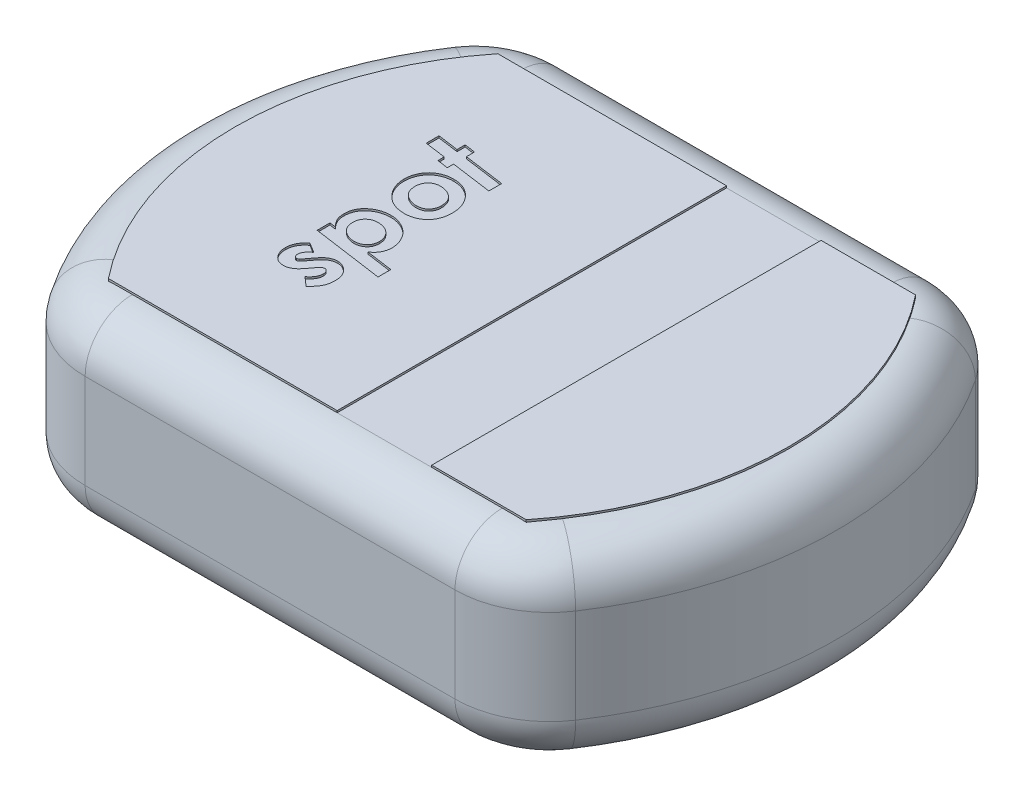
from build123d import *

# Parameters (mm, degrees)
BOSS_EXTRUDE1_DEPTH = 25.4
BOSS_EXTRUDE2_DEPTH = 0.254
FILLET1_R           = 12.7
FILLET2_R           = 6.35
SKETCH3_W           = 12.7
SKETCH3_H           = 52.324
CUT_EXTRUDE3_DEPTH  = 0.254
CUT_EXTRUDE4_DEPTH  = 0.254


with BuildPart() as part:
    # Sketch1 → Boss-Extrude1 (new body)
    with BuildSketch(Plane(origin=(0, 0, 0), x_dir=(1, 0, 0), z_dir=(0, 1, 0))):
        with BuildLine():
            Line((-31, 32.512), (31, 32.512))
            ThreePointArc((31, 32.512), (43.561, 0), (31, -32.512))
            Line((31, -32.512), (-31, -32.512))
            ThreePointArc((-31, -32.512), (-43.561, 0), (-31, 32.512))
        make_face()
    extrude(amount=BOSS_EXTRUDE1_DEPTH)

    # Sketch2 → Boss-Extrude2 (add)
    with BuildSketch(Plane(origin=(0, 25.4, 0), x_dir=(1, 0, 0), z_dir=(0, 1, 0))):
        with BuildLine():
            Line((-28.069276307, -26.162), (28.069276307, -26.162))
            ThreePointArc((28.069276307, -26.162), (37.211, 0), (28.069276307, 26.162))
            Line((28.069276307, 26.162), (-28.069276307, 26.162))
            ThreePointArc((-28.069276307, 26.162), (-37.211, 0), (-28.069276307, -26.162))
        make_face()
    extrude(amount=BOSS_EXTRUDE2_DEPTH)

    # Fillet1
    fillet1_edges = [part.edges().sort_by_distance(p)[0] for p in [
        (-31, 12.7, -32.512),
        (31, 12.7, -32.512),
        (31, 12.7, 32.512),
        (-31, 12.7, 32.512),
    ]]
    fillet(fillet1_edges, radius=FILLET1_R)

    # Fillet2
    # the kernel refuses this fillet: 6.35 mm, written as the material it takes off along each edge
    with BuildSketch(Plane(origin=(4.795375488, 0, 0), x_dir=(-0.8314250243964912, 0, 0.5556369577406582), z_dir=(0.5556369577406582, 0, 0.8314250243964912))) as fillet2_piece_1:
        with BuildLine():
            CenterArc((48.356375488 - FILLET2_R, -FILLET2_R), FILLET2_R, 0, 90)
            Line((48.356375488, -FILLET2_R), (48.356375488 + FILLET2_R * 0.02, -FILLET2_R))
            Line((48.356375488 + FILLET2_R * 0.02, -FILLET2_R), (48.356375488 + FILLET2_R * 0.02, FILLET2_R * 0.02))
            Line((48.356375488 + FILLET2_R * 0.02, FILLET2_R * 0.02), (48.356375488 - FILLET2_R, FILLET2_R * 0.02))
            Line((48.356375488 - FILLET2_R, FILLET2_R * 0.02), (48.356375488 - FILLET2_R, 0))
        make_face()
    revolve(axis=Axis((4.795375488, 0, 0), (0, -1, 0)), revolution_arc=67.509196121, mode=Mode.SUBTRACT)
    with BuildSketch(Plane(origin=(4.795375488, 25.4, 0), x_dir=(-0.8314250243964912, 0, 0.5556369577406582), z_dir=(0.5556369577406582, 0, 0.8314250243964912))) as fillet2_piece_2:
        with BuildLine():
            CenterArc((48.356375488 - FILLET2_R, FILLET2_R), FILLET2_R, 270, 90)
            Line((48.356375488, FILLET2_R), (48.356375488 + FILLET2_R * 0.02, FILLET2_R))
            Line((48.356375488 + FILLET2_R * 0.02, FILLET2_R), (48.356375488 + FILLET2_R * 0.02, -FILLET2_R * 0.02))
            Line((48.356375488 + FILLET2_R * 0.02, -FILLET2_R * 0.02), (48.356375488 - FILLET2_R, -FILLET2_R * 0.02))
            Line((48.356375488 - FILLET2_R, -FILLET2_R * 0.02), (48.356375488 - FILLET2_R, 0))
        make_face()
    revolve(axis=Axis((4.795375488, 25.4, 0), (0, -1, 0)), revolution_arc=67.509196121, mode=Mode.SUBTRACT)
    with BuildSketch(Plane(origin=(-24.850227372, 0, -32.512), x_dir=(0, 1, 0), z_dir=(1, 0, 0)), Plane(origin=(24.850227372, 25.4, 32.512), x_dir=(0, 0, -1), z_dir=(-1, 0, 0))) as fillet2_piece_3:
        with BuildLine():
            CenterArc((FILLET2_R, FILLET2_R), FILLET2_R, 180, 90)
            Line((0, FILLET2_R), (-FILLET2_R * 0.02, FILLET2_R))
            Line((-FILLET2_R * 0.02, FILLET2_R), (-FILLET2_R * 0.02, -FILLET2_R * 0.02))
            Line((-FILLET2_R * 0.02, -FILLET2_R * 0.02), (FILLET2_R, -FILLET2_R * 0.02))
            Line((FILLET2_R, -FILLET2_R * 0.02), (FILLET2_R, 0))
        make_face()
    extrude(amount=49.700454744, mode=Mode.SUBTRACT)
    with BuildSketch(Plane(origin=(-4.795375488, 0, 0), x_dir=(0.8314250243964905, 0, -0.5556369577406595), z_dir=(-0.5556369577406595, 0, -0.8314250243964905))) as fillet2_piece_4:
        with BuildLine():
            CenterArc((48.356375488 - FILLET2_R, -FILLET2_R), FILLET2_R, 0, 90)
            Line((48.356375488, -FILLET2_R), (48.356375488 + FILLET2_R * 0.02, -FILLET2_R))
            Line((48.356375488 + FILLET2_R * 0.02, -FILLET2_R), (48.356375488 + FILLET2_R * 0.02, FILLET2_R * 0.02))
            Line((48.356375488 + FILLET2_R * 0.02, FILLET2_R * 0.02), (48.356375488 - FILLET2_R, FILLET2_R * 0.02))
            Line((48.356375488 - FILLET2_R, FILLET2_R * 0.02), (48.356375488 - FILLET2_R, 0))
        make_face()
    revolve(axis=Axis((-4.795375488, 0, 0), (0, -1, 0)), revolution_arc=67.509196121, mode=Mode.SUBTRACT)
    with BuildSketch(Plane(origin=(24.850227372, 0, 32.512), x_dir=(0, 0, -1), z_dir=(-1, 0, 0)), Plane(origin=(-24.850227372, 25.4, -32.512), x_dir=(0, -1, 0), z_dir=(1, 0, 0))) as fillet2_piece_5:
        with BuildLine():
            CenterArc((FILLET2_R, -FILLET2_R), FILLET2_R, 90, 90)
            Line((0, -FILLET2_R), (-FILLET2_R * 0.02, -FILLET2_R))
            Line((-FILLET2_R * 0.02, -FILLET2_R), (-FILLET2_R * 0.02, FILLET2_R * 0.02))
            Line((-FILLET2_R * 0.02, FILLET2_R * 0.02), (FILLET2_R, FILLET2_R * 0.02))
            Line((FILLET2_R, FILLET2_R * 0.02), (FILLET2_R, 0))
        make_face()
    extrude(amount=49.700454744, mode=Mode.SUBTRACT)
    with BuildSketch(Plane(origin=(-24.850227372, 0, 19.812), x_dir=(-0.8314250243964914, 0, 0.5556369577406579), z_dir=(-0.5556369577406579, 0, -0.8314250243964914))) as fillet2_piece_6:
        with BuildLine():
            CenterArc((12.7 - FILLET2_R, FILLET2_R), FILLET2_R, 270, 90)
            Line((12.7, FILLET2_R), (12.7 + FILLET2_R * 0.02, FILLET2_R))
            Line((12.7 + FILLET2_R * 0.02, FILLET2_R), (12.7 + FILLET2_R * 0.02, -FILLET2_R * 0.02))
            Line((12.7 + FILLET2_R * 0.02, -FILLET2_R * 0.02), (12.7 - FILLET2_R, -FILLET2_R * 0.02))
            Line((12.7 - FILLET2_R, -FILLET2_R * 0.02), (12.7 - FILLET2_R, 0))
        make_face()
    revolve(axis=Axis((-24.850227372, 0, 19.812), (0, 1, 0)), revolution_arc=56.24540194, mode=Mode.SUBTRACT)
    with BuildSketch(Plane(origin=(24.850227372, 0, 19.812), x_dir=(0.8314250243964914, 0, 0.5556369577406579), z_dir=(0.5556369577406579, 0, -0.8314250243964914))) as fillet2_piece_7:
        with BuildLine():
            CenterArc((12.7 - FILLET2_R, -FILLET2_R), FILLET2_R, 0, 90)
            Line((12.7, -FILLET2_R), (12.7 + FILLET2_R * 0.02, -FILLET2_R))
            Line((12.7 + FILLET2_R * 0.02, -FILLET2_R), (12.7 + FILLET2_R * 0.02, FILLET2_R * 0.02))
            Line((12.7 + FILLET2_R * 0.02, FILLET2_R * 0.02), (12.7 - FILLET2_R, FILLET2_R * 0.02))
            Line((12.7 - FILLET2_R, FILLET2_R * 0.02), (12.7 - FILLET2_R, 0))
        make_face()
    revolve(axis=Axis((24.850227372, 0, 19.812), (0, -1, 0)), revolution_arc=56.24540194, mode=Mode.SUBTRACT)
    with BuildSketch(Plane(origin=(24.850227372, 0, -19.812), x_dir=(0, 0, -1), z_dir=(-1, 0, 0))) as fillet2_piece_8:
        with BuildLine():
            CenterArc((12.7 - FILLET2_R, -FILLET2_R), FILLET2_R, 0, 90)
            Line((12.7, -FILLET2_R), (12.7 + FILLET2_R * 0.02, -FILLET2_R))
            Line((12.7 + FILLET2_R * 0.02, -FILLET2_R), (12.7 + FILLET2_R * 0.02, FILLET2_R * 0.02))
            Line((12.7 + FILLET2_R * 0.02, FILLET2_R * 0.02), (12.7 - FILLET2_R, FILLET2_R * 0.02))
            Line((12.7 - FILLET2_R, FILLET2_R * 0.02), (12.7 - FILLET2_R, 0))
        make_face()
    revolve(axis=Axis((24.850227372, 0, -19.812), (0, -1, 0)), revolution_arc=56.24540194, mode=Mode.SUBTRACT)
    with BuildSketch(Plane(origin=(-24.850227372, 0, -19.812), x_dir=(0, 0, -1), z_dir=(1, 0, 0))) as fillet2_piece_9:
        with BuildLine():
            CenterArc((12.7 - FILLET2_R, FILLET2_R), FILLET2_R, 270, 90)
            Line((12.7, FILLET2_R), (12.7 + FILLET2_R * 0.02, FILLET2_R))
            Line((12.7 + FILLET2_R * 0.02, FILLET2_R), (12.7 + FILLET2_R * 0.02, -FILLET2_R * 0.02))
            Line((12.7 + FILLET2_R * 0.02, -FILLET2_R * 0.02), (12.7 - FILLET2_R, -FILLET2_R * 0.02))
            Line((12.7 - FILLET2_R, -FILLET2_R * 0.02), (12.7 - FILLET2_R, 0))
        make_face()
    revolve(axis=Axis((-24.850227372, 0, -19.812), (0, 1, 0)), revolution_arc=56.24540194, mode=Mode.SUBTRACT)
    with BuildSketch(Plane(origin=(-4.795375488, 25.4, 0), x_dir=(0.8314250243964905, 0, -0.5556369577406595), z_dir=(-0.5556369577406595, 0, -0.8314250243964905))) as fillet2_piece_10:
        with BuildLine():
            CenterArc((48.356375488 - FILLET2_R, FILLET2_R), FILLET2_R, 270, 90)
            Line((48.356375488, FILLET2_R), (48.356375488 + FILLET2_R * 0.02, FILLET2_R))
            Line((48.356375488 + FILLET2_R * 0.02, FILLET2_R), (48.356375488 + FILLET2_R * 0.02, -FILLET2_R * 0.02))
            Line((48.356375488 + FILLET2_R * 0.02, -FILLET2_R * 0.02), (48.356375488 - FILLET2_R, -FILLET2_R * 0.02))
            Line((48.356375488 - FILLET2_R, -FILLET2_R * 0.02), (48.356375488 - FILLET2_R, 0))
        make_face()
    revolve(axis=Axis((-4.795375488, 25.4, 0), (0, -1, 0)), revolution_arc=67.509196121, mode=Mode.SUBTRACT)
    with BuildSketch(Plane(origin=(-24.850227372, 25.4, 19.812), x_dir=(-0.8314250243964914, 0, 0.5556369577406579), z_dir=(-0.5556369577406579, 0, -0.8314250243964914))) as fillet2_piece_11_section:
        with BuildLine():
            CenterArc((12.7 - FILLET2_R, -FILLET2_R), FILLET2_R, 0, 90)
            Line((12.7, -FILLET2_R), (12.7 + FILLET2_R * 0.02, -FILLET2_R))
            Line((12.7 + FILLET2_R * 0.02, -FILLET2_R), (12.7 + FILLET2_R * 0.02, FILLET2_R * 0.02))
            Line((12.7 + FILLET2_R * 0.02, FILLET2_R * 0.02), (12.7 - FILLET2_R, FILLET2_R * 0.02))
            Line((12.7 - FILLET2_R, FILLET2_R * 0.02), (12.7 - FILLET2_R, 0))
        make_face()
    fillet2_piece_11 = revolve(axis=Axis((-24.850227372, 25.4, 19.812), (0, 1, 0)), revolution_arc=56.24540194, mode=Mode.PRIVATE)
    fillet2_piece_11 = fillet2_piece_11 - Plane(origin=(4.795375488, 25.075741266, 0), x_dir=(-0.7823729472848935, 0, -0.6228102209796731), z_dir=(0, -1, 0)) * Cylinder(42.006375488, 52, mode=Mode.PRIVATE)
    fillet2_piece_11 = split(fillet2_piece_11, bisect_by=Plane(origin=(-31.876224532, 25.075741266, 26.162), z_dir=(0, 0, -1)), keep=Keep.TOP, mode=Mode.PRIVATE)
    add(fillet2_piece_11, mode=Mode.SUBTRACT)
    with BuildSketch(Plane(origin=(-24.850227372, 25.4, 19.812), x_dir=(-0.8314250243964914, 0, 0.5556369577406579), z_dir=(-0.5556369577406579, 0, -0.8314250243964914))) as fillet2_piece_12_section:
        with BuildLine():
            CenterArc((12.7 - FILLET2_R, -FILLET2_R), FILLET2_R, 0, 90)
            Line((12.7, -FILLET2_R), (12.7 + FILLET2_R * 0.02, -FILLET2_R))
            Line((12.7 + FILLET2_R * 0.02, -FILLET2_R), (12.7 + FILLET2_R * 0.02, FILLET2_R * 0.02))
            Line((12.7 + FILLET2_R * 0.02, FILLET2_R * 0.02), (12.7 - FILLET2_R, FILLET2_R * 0.02))
            Line((12.7 - FILLET2_R, FILLET2_R * 0.02), (12.7 - FILLET2_R, 0))
        make_face()
    fillet2_piece_12 = revolve(axis=Axis((-24.850227372, 25.4, 19.812), (0, 1, 0)), revolution_arc=56.24540194, mode=Mode.PRIVATE)
    fillet2_piece_12 = fillet2_piece_12 & Plane(origin=(4.795375488, 25.294711271, 0), x_dir=(-0.7823729472848935, 0, -0.6228102209796731), z_dir=(0, -1, 0)) * Cylinder(42.006375488, 52, mode=Mode.PRIVATE)
    fillet2_piece_12 = split(fillet2_piece_12, bisect_by=Plane(origin=(-25.742042557, 25.294711271, 26.162), z_dir=(0, 0, 1)), keep=Keep.TOP, mode=Mode.PRIVATE)
    add(fillet2_piece_12, mode=Mode.SUBTRACT)
    with BuildSketch(Plane(origin=(-24.850227372, 25.4, 19.812), x_dir=(-0.8314250243964914, 0, 0.5556369577406579), z_dir=(-0.5556369577406579, 0, -0.8314250243964914))) as fillet2_piece_13_section:
        with BuildLine():
            CenterArc((12.7 - FILLET2_R, -FILLET2_R), FILLET2_R, 0, 90)
            Line((12.7, -FILLET2_R), (12.7 + FILLET2_R * 0.02, -FILLET2_R))
            Line((12.7 + FILLET2_R * 0.02, -FILLET2_R), (12.7 + FILLET2_R * 0.02, FILLET2_R * 0.02))
            Line((12.7 + FILLET2_R * 0.02, FILLET2_R * 0.02), (12.7 - FILLET2_R, FILLET2_R * 0.02))
            Line((12.7 - FILLET2_R, FILLET2_R * 0.02), (12.7 - FILLET2_R, 0))
        make_face()
    fillet2_piece_13 = revolve(axis=Axis((-24.850227372, 25.4, 19.812), (0, 1, 0)), revolution_arc=56.24540194, mode=Mode.PRIVATE)
    fillet2_piece_13 = fillet2_piece_13 - Plane(origin=(4.795375488, 23.784162889, 0), x_dir=(-0.7823729472848935, 0, -0.6228102209796731), z_dir=(0, -1, 0)) * Cylinder(42.006375488, 52, mode=Mode.PRIVATE)
    fillet2_piece_13 = split(fillet2_piece_13, bisect_by=Plane(origin=(-30.028937525, 23.784162889, 26.162), z_dir=(0, 0, 1)), keep=Keep.TOP, mode=Mode.PRIVATE)
    add(fillet2_piece_13, mode=Mode.SUBTRACT)
    with BuildSketch(Plane(origin=(24.850227372, 25.4, 19.812), x_dir=(0.8314250243964914, 0, 0.5556369577406579), z_dir=(0.5556369577406579, 0, -0.8314250243964914))) as fillet2_piece_14_section:
        with BuildLine():
            CenterArc((12.7 - FILLET2_R, FILLET2_R), FILLET2_R, 270, 90)
            Line((12.7, FILLET2_R), (12.7 + FILLET2_R * 0.02, FILLET2_R))
            Line((12.7 + FILLET2_R * 0.02, FILLET2_R), (12.7 + FILLET2_R * 0.02, -FILLET2_R * 0.02))
            Line((12.7 + FILLET2_R * 0.02, -FILLET2_R * 0.02), (12.7 - FILLET2_R, -FILLET2_R * 0.02))
            Line((12.7 - FILLET2_R, -FILLET2_R * 0.02), (12.7 - FILLET2_R, 0))
        make_face()
    fillet2_piece_14 = revolve(axis=Axis((24.850227372, 25.4, 19.812), (0, -1, 0)), revolution_arc=56.24540194, mode=Mode.PRIVATE)
    fillet2_piece_14 = fillet2_piece_14 - Plane(origin=(-4.795375488, 25.075741312, 0), x_dir=(0.7823729472848935, 0, 0.6228102209796733), z_dir=(0, -1, 0)) * Cylinder(42.006375488, 52, mode=Mode.PRIVATE)
    fillet2_piece_14 = split(fillet2_piece_14, bisect_by=Plane(origin=(31.876224679, 25.075741312, 26.162), z_dir=(0, 0, -1)), keep=Keep.TOP, mode=Mode.PRIVATE)
    add(fillet2_piece_14, mode=Mode.SUBTRACT)
    with BuildSketch(Plane(origin=(24.850227372, 25.4, 19.812), x_dir=(0.8314250243964914, 0, 0.5556369577406579), z_dir=(0.5556369577406579, 0, -0.8314250243964914))) as fillet2_piece_15_section:
        with BuildLine():
            CenterArc((12.7 - FILLET2_R, FILLET2_R), FILLET2_R, 270, 90)
            Line((12.7, FILLET2_R), (12.7 + FILLET2_R * 0.02, FILLET2_R))
            Line((12.7 + FILLET2_R * 0.02, FILLET2_R), (12.7 + FILLET2_R * 0.02, -FILLET2_R * 0.02))
            Line((12.7 + FILLET2_R * 0.02, -FILLET2_R * 0.02), (12.7 - FILLET2_R, -FILLET2_R * 0.02))
            Line((12.7 - FILLET2_R, -FILLET2_R * 0.02), (12.7 - FILLET2_R, 0))
        make_face()
    fillet2_piece_15 = revolve(axis=Axis((24.850227372, 25.4, 19.812), (0, -1, 0)), revolution_arc=56.24540194, mode=Mode.PRIVATE)
    fillet2_piece_15 = fillet2_piece_15 & Plane(origin=(-4.795375488, 25.294711254, 0), x_dir=(0.7823729472848935, 0, 0.6228102209796733), z_dir=(0, -1, 0)) * Cylinder(42.006375488, 52, mode=Mode.PRIVATE)
    fillet2_piece_15 = split(fillet2_piece_15, bisect_by=Plane(origin=(25.742042624, 25.294711254, 26.162), z_dir=(0, 0, 1)), keep=Keep.TOP, mode=Mode.PRIVATE)
    add(fillet2_piece_15, mode=Mode.SUBTRACT)
    with BuildSketch(Plane(origin=(24.850227372, 25.4, 19.812), x_dir=(0.8314250243964914, 0, 0.5556369577406579), z_dir=(0.5556369577406579, 0, -0.8314250243964914))) as fillet2_piece_16_section:
        with BuildLine():
            CenterArc((12.7 - FILLET2_R, FILLET2_R), FILLET2_R, 270, 90)
            Line((12.7, FILLET2_R), (12.7 + FILLET2_R * 0.02, FILLET2_R))
            Line((12.7 + FILLET2_R * 0.02, FILLET2_R), (12.7 + FILLET2_R * 0.02, -FILLET2_R * 0.02))
            Line((12.7 + FILLET2_R * 0.02, -FILLET2_R * 0.02), (12.7 - FILLET2_R, -FILLET2_R * 0.02))
            Line((12.7 - FILLET2_R, -FILLET2_R * 0.02), (12.7 - FILLET2_R, 0))
        make_face()
    fillet2_piece_16 = revolve(axis=Axis((24.850227372, 25.4, 19.812), (0, -1, 0)), revolution_arc=56.24540194, mode=Mode.PRIVATE)
    fillet2_piece_16 = fillet2_piece_16 - Plane(origin=(-4.795375488, 23.784162865, 0), x_dir=(0.7823729472848935, 0, 0.6228102209796733), z_dir=(0, -1, 0)) * Cylinder(42.006375488, 52, mode=Mode.PRIVATE)
    fillet2_piece_16 = split(fillet2_piece_16, bisect_by=Plane(origin=(30.028937498, 23.784162865, 26.162), z_dir=(0, 0, 1)), keep=Keep.TOP, mode=Mode.PRIVATE)
    add(fillet2_piece_16, mode=Mode.SUBTRACT)
    with BuildSketch(Plane(origin=(24.850227372, 25.4, -19.812), x_dir=(0, 0, -1), z_dir=(-1, 0, 0))) as fillet2_piece_17_section:
        with BuildLine():
            CenterArc((12.7 - FILLET2_R, FILLET2_R), FILLET2_R, 270, 90)
            Line((12.7 - FILLET2_R, 0), (12.7 - FILLET2_R, -FILLET2_R * 0.02))
            Line((12.7 - FILLET2_R, -FILLET2_R * 0.02), (12.7 + FILLET2_R * 0.02, -FILLET2_R * 0.02))
            Line((12.7 + FILLET2_R * 0.02, -FILLET2_R * 0.02), (12.7 + FILLET2_R * 0.02, FILLET2_R))
            Line((12.7 + FILLET2_R * 0.02, FILLET2_R), (12.7, FILLET2_R))
        make_face()
    fillet2_piece_17 = revolve(axis=Axis((24.850227372, 25.4, -19.812), (0, -1, 0)), revolution_arc=56.24540194, mode=Mode.PRIVATE)
    fillet2_piece_17 = split(fillet2_piece_17, bisect_by=Plane(origin=(30.028937546, 23.784162878, -26.162), z_dir=(0, 0, -1)), keep=Keep.TOP, mode=Mode.PRIVATE)
    fillet2_piece_17 = fillet2_piece_17 - Plane(origin=(-4.795375488, 23.784162878, 0), x_dir=(0.7823729472848935, 0, 0.6228102209796733), z_dir=(0, -1, 0)) * Cylinder(42.006375488, 52, mode=Mode.PRIVATE)
    add(fillet2_piece_17, mode=Mode.SUBTRACT)
    with BuildSketch(Plane(origin=(24.850227372, 25.4, -19.812), x_dir=(0, 0, -1), z_dir=(-1, 0, 0))) as fillet2_piece_18_section:
        with BuildLine():
            CenterArc((12.7 - FILLET2_R, FILLET2_R), FILLET2_R, 270, 90)
            Line((12.7 - FILLET2_R, 0), (12.7 - FILLET2_R, -FILLET2_R * 0.02))
            Line((12.7 - FILLET2_R, -FILLET2_R * 0.02), (12.7 + FILLET2_R * 0.02, -FILLET2_R * 0.02))
            Line((12.7 + FILLET2_R * 0.02, -FILLET2_R * 0.02), (12.7 + FILLET2_R * 0.02, FILLET2_R))
            Line((12.7 + FILLET2_R * 0.02, FILLET2_R), (12.7, FILLET2_R))
        make_face()
    fillet2_piece_18 = revolve(axis=Axis((24.850227372, 25.4, -19.812), (0, -1, 0)), revolution_arc=56.24540194, mode=Mode.PRIVATE)
    fillet2_piece_18 = split(fillet2_piece_18, bisect_by=Plane(origin=(25.742042551, 25.29471127, -26.162), z_dir=(0, 0, -1)), keep=Keep.TOP, mode=Mode.PRIVATE)
    fillet2_piece_18 = fillet2_piece_18 & Plane(origin=(-4.795375488, 25.29471127, 0), x_dir=(0.7823729472848935, 0, 0.6228102209796733), z_dir=(0, -1, 0)) * Cylinder(42.006375488, 52, mode=Mode.PRIVATE)
    add(fillet2_piece_18, mode=Mode.SUBTRACT)
    with BuildSketch(Plane(origin=(24.850227372, 25.4, -19.812), x_dir=(0, 0, -1), z_dir=(-1, 0, 0))) as fillet2_piece_19_section:
        with BuildLine():
            CenterArc((12.7 - FILLET2_R, FILLET2_R), FILLET2_R, 270, 90)
            Line((12.7 - FILLET2_R, 0), (12.7 - FILLET2_R, -FILLET2_R * 0.02))
            Line((12.7 - FILLET2_R, -FILLET2_R * 0.02), (12.7 + FILLET2_R * 0.02, -FILLET2_R * 0.02))
            Line((12.7 + FILLET2_R * 0.02, -FILLET2_R * 0.02), (12.7 + FILLET2_R * 0.02, FILLET2_R))
            Line((12.7 + FILLET2_R * 0.02, FILLET2_R), (12.7, FILLET2_R))
        make_face()
    fillet2_piece_19 = revolve(axis=Axis((24.850227372, 25.4, -19.812), (0, -1, 0)), revolution_arc=56.24540194, mode=Mode.PRIVATE)
    fillet2_piece_19 = split(fillet2_piece_19, bisect_by=Plane(origin=(31.876224423, 25.075741235, -26.162), z_dir=(0, 0, 1)), keep=Keep.TOP, mode=Mode.PRIVATE)
    fillet2_piece_19 = fillet2_piece_19 - Plane(origin=(-4.795375488, 25.075741235, 0), x_dir=(0.7823729472848935, 0, 0.6228102209796733), z_dir=(0, -1, 0)) * Cylinder(42.006375488, 52, mode=Mode.PRIVATE)
    add(fillet2_piece_19, mode=Mode.SUBTRACT)
    with BuildSketch(Plane(origin=(-24.850227372, 25.4, -19.812), x_dir=(0, 0, -1), z_dir=(1, 0, 0))) as fillet2_piece_20_section:
        with BuildLine():
            CenterArc((12.7 - FILLET2_R, -FILLET2_R), FILLET2_R, 0, 90)
            Line((12.7 - FILLET2_R, 0), (12.7 - FILLET2_R, FILLET2_R * 0.02))
            Line((12.7 - FILLET2_R, FILLET2_R * 0.02), (12.7 + FILLET2_R * 0.02, FILLET2_R * 0.02))
            Line((12.7 + FILLET2_R * 0.02, FILLET2_R * 0.02), (12.7 + FILLET2_R * 0.02, -FILLET2_R))
            Line((12.7 + FILLET2_R * 0.02, -FILLET2_R), (12.7, -FILLET2_R))
        make_face()
    fillet2_piece_20 = revolve(axis=Axis((-24.850227372, 25.4, -19.812), (0, 1, 0)), revolution_arc=56.24540194, mode=Mode.PRIVATE)
    fillet2_piece_20 = fillet2_piece_20 - Plane(origin=(4.795375488, 23.78416288, 0), x_dir=(-0.7823729472848935, 0, -0.6228102209796731), z_dir=(0, -1, 0)) * Cylinder(42.006375488, 52, mode=Mode.PRIVATE)
    fillet2_piece_20 = split(fillet2_piece_20, bisect_by=Plane(origin=(-30.028937479, 23.78416288, -26.162), z_dir=(0, 0, -1)), keep=Keep.TOP, mode=Mode.PRIVATE)
    add(fillet2_piece_20, mode=Mode.SUBTRACT)
    with BuildSketch(Plane(origin=(-24.850227372, 25.4, -19.812), x_dir=(0, 0, -1), z_dir=(1, 0, 0))) as fillet2_piece_21_section:
        with BuildLine():
            CenterArc((12.7 - FILLET2_R, -FILLET2_R), FILLET2_R, 0, 90)
            Line((12.7 - FILLET2_R, 0), (12.7 - FILLET2_R, FILLET2_R * 0.02))
            Line((12.7 - FILLET2_R, FILLET2_R * 0.02), (12.7 + FILLET2_R * 0.02, FILLET2_R * 0.02))
            Line((12.7 + FILLET2_R * 0.02, FILLET2_R * 0.02), (12.7 + FILLET2_R * 0.02, -FILLET2_R))
            Line((12.7 + FILLET2_R * 0.02, -FILLET2_R), (12.7, -FILLET2_R))
        make_face()
    fillet2_piece_21 = revolve(axis=Axis((-24.850227372, 25.4, -19.812), (0, 1, 0)), revolution_arc=56.24540194, mode=Mode.PRIVATE)
    fillet2_piece_21 = fillet2_piece_21 & Plane(origin=(4.795375488, 25.294711258, 0), x_dir=(-0.7823729472848935, 0, -0.6228102209796731), z_dir=(0, -1, 0)) * Cylinder(42.006375488, 52, mode=Mode.PRIVATE)
    fillet2_piece_21 = split(fillet2_piece_21, bisect_by=Plane(origin=(-25.742042579, 25.294711258, -26.162), z_dir=(0, 0, -1)), keep=Keep.TOP, mode=Mode.PRIVATE)
    add(fillet2_piece_21, mode=Mode.SUBTRACT)
    with BuildSketch(Plane(origin=(-24.850227372, 25.4, -19.812), x_dir=(0, 0, -1), z_dir=(1, 0, 0))) as fillet2_piece_22_section:
        with BuildLine():
            CenterArc((12.7 - FILLET2_R, -FILLET2_R), FILLET2_R, 0, 90)
            Line((12.7 - FILLET2_R, 0), (12.7 - FILLET2_R, FILLET2_R * 0.02))
            Line((12.7 - FILLET2_R, FILLET2_R * 0.02), (12.7 + FILLET2_R * 0.02, FILLET2_R * 0.02))
            Line((12.7 + FILLET2_R * 0.02, FILLET2_R * 0.02), (12.7 + FILLET2_R * 0.02, -FILLET2_R))
            Line((12.7 + FILLET2_R * 0.02, -FILLET2_R), (12.7, -FILLET2_R))
        make_face()
    fillet2_piece_22 = revolve(axis=Axis((-24.850227372, 25.4, -19.812), (0, 1, 0)), revolution_arc=56.24540194, mode=Mode.PRIVATE)
    fillet2_piece_22 = fillet2_piece_22 - Plane(origin=(4.795375488, 25.075741283, 0), x_dir=(-0.7823729472848935, 0, -0.6228102209796731), z_dir=(0, -1, 0)) * Cylinder(42.006375488, 52, mode=Mode.PRIVATE)
    fillet2_piece_22 = split(fillet2_piece_22, bisect_by=Plane(origin=(-31.876224552, 25.075741283, -26.162), z_dir=(0, 0, 1)), keep=Keep.TOP, mode=Mode.PRIVATE)
    add(fillet2_piece_22, mode=Mode.SUBTRACT)

    # Sketch3 → Cut-Extrude3 (cut)
    with BuildSketch(Plane(origin=(0, 25.654, 0), x_dir=(1, 0, 0), z_dir=(0, 1, 0))):
        with Locations((9.019276307, 0)):
            Rectangle(SKETCH3_W, SKETCH3_H)
    extrude(amount=-CUT_EXTRUDE3_DEPTH, mode=Mode.SUBTRACT)

    # Sketch4 → Cut-Extrude4 (cut)
    # profile 1 of 4: a face of its own
    with BuildSketch(Plane(origin=(0, 25.654, 0), x_dir=(1, 0, 0), z_dir=(0, 1, 0))):
        with BuildLine():
            Line((-18.628320313, -8.511823918), (-17.319396034, -9.322746394))
            add(Edge.make_bspline(
                [(-17.319396034, -9.322746394), (-17.390245987, -9.374387086), (-17.526637263, -9.473799148), (-17.709556948, -9.635993639), (-17.860734027, -9.804583595), (-17.9841247, -9.974463737), (-18.077653976, -10.14346762), (-18.14360485, -10.308273139), (-18.18687617, -10.467269206), (-18.192480039, -10.572908926), (-18.195192308, -10.624038462)],
                knots=[0, 0, 0, 0, 1.293564396, 2.490204874, 3.600320566, 4.629367154, 5.583082858, 6.442462234, 7.246153028, 8, 8, 8, 8], degree=3))
            add(Edge.make_bspline(
                [(-18.195192308, -10.624038462), (-18.193743773, -10.661026052), (-18.190916979, -10.733206813), (-18.168364329, -10.837648701), (-18.127046865, -10.931692495), (-18.074824482, -11.015821264), (-18.010491259, -11.083853439), (-17.941369565, -11.134264639), (-17.868097244, -11.168787818), (-17.816489145, -11.171967734), (-17.790685096, -11.173557692)],
                knots=[0, 0, 0, 0, 1.182062799, 2.306778901, 3.39069143, 4.451083941, 5.457882146, 6.360773834, 7.180386917, 8, 8, 8, 8], degree=3))
            add(Edge.make_bspline(
                [(-17.790685096, -11.173557692), (-17.76563383, -11.172250097), (-17.714314013, -11.169571369), (-17.639250922, -11.141165163), (-17.561536209, -11.104719276), (-17.515234136, -11.067177387), (-17.491120793, -11.047626202)],
                knots=[0, 0, 0, 0, 0.903144459, 1.85017425, 2.880406844, 4, 4, 4, 4], degree=3))
            add(Edge.make_bspline(
                [(-17.491120793, -11.047626202), (-17.476890691, -11.035149017), (-17.444372923, -11.006636908), (-17.395445249, -10.951714933), (-17.33626805, -10.883067634), (-17.267594652, -10.799528444), (-17.192329916, -10.699621303), (-17.104945572, -10.587378285), (-17.012593954, -10.456930255), (-16.947341903, -10.365164798), (-16.912980769, -10.316841947)],
                knots=[0, 0, 0, 0, 0.486262068, 1.111176692, 1.888157049, 2.817936484, 3.890888726, 5.104451828, 6.475230771, 8, 8, 8, 8], degree=3))
            add(Edge.make_bspline(
                [(-16.912980769, -10.316841947), (-16.857461247, -10.238920693), (-16.750341502, -10.088578892), (-16.588226358, -9.87652893), (-16.431641502, -9.686223442), (-16.283439561, -9.514417431), (-16.137675412, -9.366597638), (-16.001898357, -9.236057384), (-15.870640731, -9.127441384), (-15.705241334, -9.01166508), (-15.493244797, -8.900188123), (-15.230907398, -8.801169874), (-14.956657012, -8.742118039), (-14.77051538, -8.734890844), (-14.676742788, -8.73125)],
                knots=[0, 0, 0, 0, 1.202154954, 2.319445986, 3.352938761, 4.298694362, 5.169015858, 5.960473349, 6.664466163, 7.307385695, 8.494383628, 9.66264395, 10.822509872, 12, 12, 12, 12], degree=3))
            add(Edge.make_bspline(
                [(-14.676742788, -8.73125), (-14.614279317, -8.732914315), (-14.489235716, -8.736246052), (-14.303909686, -8.768608688), (-14.120695052, -8.817847701), (-13.941091947, -8.889912879), (-13.762700528, -8.979127899), (-13.588942055, -9.091592604), (-13.416361003, -9.221875409), (-13.24792843, -9.371118401), (-13.089205649, -9.538424622), (-12.953549921, -9.728243506), (-12.835905482, -9.933530089), (-12.739898548, -10.158109738), (-12.669127011, -10.401994418), (-12.614662964, -10.662063503), (-12.585067777, -10.940733334), (-12.580327488, -11.132152744), (-12.577884615, -11.230799279)],
                knots=[0, 0, 0, 0, 0.823995764, 1.64953043, 2.476601134, 3.324884382, 4.199886903, 5.106045327, 6.053255199, 7.052557025, 8.074465297, 9.090665024, 10.124918945, 11.19334482, 12.306504175, 13.472475582, 14.69745954, 16, 16, 16, 16], degree=3))
            add(Edge.make_bspline(
                [(-12.577884615, -11.230799279), (-12.581116442, -11.345467706), (-12.587470376, -11.570911607), (-12.639577139, -11.900940224), (-12.728394437, -12.214989405), (-12.831194923, -12.465458636), (-12.932175988, -12.661896324), (-13.025720355, -12.810796722), (-13.130189973, -12.965204177), (-13.248801901, -13.12411708), (-13.383406065, -13.286313426), (-13.531238755, -13.453457087), (-13.694729458, -13.624112205), (-13.810159939, -13.737036968), (-13.869636418, -13.795222356)],
                knots=[0, 0, 0, 0, 1.391902403, 2.736550212, 4.04459169, 5.346851969, 6.016987642, 6.724319631, 7.480478066, 8.280597195, 9.131020127, 10.039203976, 10.989684156, 12, 12, 12, 12], degree=3))
            Line((-13.869636418, -13.795222356), (-15.079341947, -12.743885216))
            add(Edge.make_bspline(
                [(-15.079341947, -12.743885216), (-15.007160359, -12.684548371), (-14.867208885, -12.569501319), (-14.679588593, -12.384759226), (-14.52155069, -12.194940518), (-14.392275092, -12.00052449), (-14.289748906, -11.802678209), (-14.219053239, -11.598874478), (-14.172062303, -11.391958639), (-14.16760917, -11.251403805), (-14.165384615, -11.181189904)],
                knots=[0, 0, 0, 0, 1.194983961, 2.316931099, 3.362897671, 4.349081709, 5.298844883, 6.204687641, 7.103155112, 8, 8, 8, 8], degree=3))
            add(Edge.make_bspline(
                [(-14.165384615, -11.181189904), (-14.166820257, -11.127582877), (-14.169564251, -11.025121864), (-14.201069086, -10.880337814), (-14.249869803, -10.751428383), (-14.320982234, -10.642790222), (-14.405039986, -10.554952969), (-14.496181605, -10.48739362), (-14.598902262, -10.44903017), (-14.669449783, -10.443619704), (-14.705363582, -10.440865385)],
                knots=[0, 0, 0, 0, 1.262863261, 2.413755393, 3.478337955, 4.49818724, 5.453495978, 6.336264993, 7.153038342, 8, 8, 8, 8], degree=3))
            add(Edge.make_bspline(
                [(-14.705363582, -10.440865385), (-14.734858362, -10.442769651), (-14.795801438, -10.446704307), (-14.886194201, -10.478360529), (-14.979320049, -10.523689784), (-15.055324236, -10.581334283), (-15.12214198, -10.640283096), (-15.181476757, -10.702699934), (-15.249469175, -10.78095757), (-15.327633594, -10.874544261), (-15.41573634, -10.983698775), (-15.513038463, -11.109211236), (-15.617152895, -11.252790254), (-15.689935969, -11.353539663), (-15.728079928, -11.406340144)],
                knots=[0, 0, 0, 0, 0.730705261, 1.509807026, 2.357288366, 3.29541125, 3.865889586, 4.569470673, 5.431105645, 6.440057403, 7.596752151, 8.913931468, 10.38266143, 12, 12, 12, 12], degree=3))
            add(Edge.make_bspline(
                [(-15.728079928, -11.406340144), (-15.772982785, -11.468219643), (-15.860247735, -11.588477279), (-15.990713697, -11.75947372), (-16.117905026, -11.914342196), (-16.237143153, -12.056395844), (-16.353653925, -12.18183033), (-16.464192969, -12.293472898), (-16.570547667, -12.389169007), (-16.642353543, -12.444711956), (-16.676382212, -12.471033654)],
                knots=[0, 0, 0, 0, 1.282428707, 2.492293047, 3.606974981, 4.643787634, 5.602579517, 6.477648517, 7.278560515, 8, 8, 8, 8], degree=3))
            add(Edge.make_bspline(
                [(-16.676382212, -12.471033654), (-16.768210305, -12.533640727), (-16.946713517, -12.655341648), (-17.237833934, -12.787657754), (-17.538471446, -12.866587893), (-17.742534508, -12.877661159), (-17.844110577, -12.883173077)],
                knots=[0, 0, 0, 0, 1.057740444, 2.05612531, 3.032401325, 4, 4, 4, 4], degree=3))
            add(Edge.make_bspline(
                [(-17.844110577, -12.883173077), (-17.914222242, -12.881767691), (-18.052060228, -12.879004734), (-18.252676837, -12.844599683), (-18.443833519, -12.793940387), (-18.623782647, -12.720126236), (-18.795982054, -12.628769774), (-18.955776981, -12.512548404), (-19.107889209, -12.378928983), (-19.246119655, -12.224216772), (-19.369559606, -12.055422061), (-19.482827801, -11.880002582), (-19.573250608, -11.693261188), (-19.650117079, -11.500956482), (-19.70984776, -11.301110844), (-19.750961617, -11.093444645), (-19.779433214, -10.878597036), (-19.78159902, -10.732255745), (-19.782692308, -10.658383413)],
                knots=[0, 0, 0, 0, 1.021630065, 2.008502182, 2.960568009, 3.90126412, 4.839440403, 5.797185411, 6.776483436, 7.788164727, 8.816178467, 9.825218622, 10.829341502, 11.837229321, 12.844091735, 13.866690309, 14.923116238, 16, 16, 16, 16], degree=3))
            add(Edge.make_bspline(
                [(-19.782692308, -10.658383413), (-19.779070539, -10.554440764), (-19.771838496, -10.346885328), (-19.711915062, -10.040733478), (-19.618376997, -9.741879601), (-19.485979162, -9.454732262), (-19.321548698, -9.181605508), (-19.120274936, -8.932696609), (-18.891396347, -8.70437223), (-18.716615186, -8.57644793), (-18.628320313, -8.511823918)],
                knots=[0, 0, 0, 0, 0.983289154, 1.963457831, 2.942257014, 3.941873125, 4.949724397, 5.952129247, 6.965469223, 8, 8, 8, 8], degree=3))
        make_face()
    # profile 2 of 4: a face of its own
    with BuildSketch(Plane(origin=(0, 25.654, 0), x_dir=(1, 0, 0), z_dir=(0, 1, 0))):
        with BuildLine():
            Line((-10.135576923, -6.145838341), (-10.135576923, -7.870718149))
            Line((-10.135576923, -7.870718149), (-19.660576923, -6.52172476))
            Line((-19.660576923, -6.52172476), (-19.660576923, -4.796844952))
            Line((-19.660576923, -4.796844952), (-18.805769231, -4.918960337))
            add(Edge.make_bspline(
                [(-18.805769231, -4.918960337), (-18.892368446, -4.829258083), (-19.056884341, -4.658847227), (-19.270864233, -4.395860799), (-19.44244594, -4.142156426), (-19.574646384, -3.892293121), (-19.670082176, -3.63886264), (-19.733857612, -3.374709032), (-19.775639601, -3.096826525), (-19.780306896, -2.906121459), (-19.782692308, -2.808653846)],
                knots=[0, 0, 0, 0, 1.247674111, 2.370254989, 3.389109255, 4.30892262, 5.193421291, 6.09210412, 7.024891887, 8, 8, 8, 8], degree=3))
            add(Edge.make_bspline(
                [(-19.782692308, -2.808653846), (-19.780105014, -2.696527094), (-19.775052459, -2.477562135), (-19.725511642, -2.158486617), (-19.647710094, -1.85705673), (-19.53874822, -1.572191118), (-19.396691813, -1.305890555), (-19.223214589, -1.05728066), (-19.017991591, -0.827605151), (-18.783145099, -0.619567605), (-18.529295727, -0.43266524), (-18.263279459, -0.267917546), (-17.987621146, -0.12684918), (-17.699805941, -0.015495951), (-17.403755246, 0.075695489), (-17.097066439, 0.138337509), (-16.780303789, 0.174793434), (-16.565809959, 0.1803521), (-16.45695613, 0.183173077)],
                knots=[0, 0, 0, 0, 1.075619862, 2.10050727, 3.091164438, 4.059426359, 5.020811771, 5.981111004, 6.962677735, 7.970105238, 8.987253403, 9.985164385, 10.97082368, 11.954893445, 12.943742981, 13.94113091, 14.955141108, 16, 16, 16, 16], degree=3))
            add(Edge.make_bspline(
                [(-16.45695613, 0.183173077), (-16.372932998, 0.181909483), (-16.205785249, 0.179395807), (-15.956704464, 0.152866796), (-15.70986486, 0.113543008), (-15.465617487, 0.056234197), (-15.224972342, -0.018675866), (-14.987547582, -0.109058894), (-14.752382837, -0.21341464), (-14.522944474, -0.335670965), (-14.300285297, -0.470258773), (-14.089043884, -0.617224363), (-13.888747316, -0.773578806), (-13.704449721, -0.94394252), (-13.531668039, -1.124187625), (-13.370914222, -1.31484948), (-13.224006677, -1.518261567), (-13.089162641, -1.730255083), (-12.969889748, -1.949422883), (-12.863441831, -2.170968412), (-12.77655104, -2.396665502), (-12.702988542, -2.623730369), (-12.648039363, -2.853568942), (-12.607899255, -3.08550245), (-12.581786944, -3.320049791), (-12.579186719, -3.477676516), (-12.577884615, -3.556610577)],
                knots=[0, 0, 0, 0, 1.013744927, 2.016649225, 3.019935364, 4.029136155, 5.041630568, 6.059581021, 7.093869338, 8.144634056, 9.195202477, 10.232221893, 11.248869045, 12.259411897, 13.258401288, 14.260923601, 15.266644227, 16.28459468, 17.291164523, 18.276643203, 19.248847722, 20.207778681, 21.155459706, 22.098184484, 23.047635977, 24, 24, 24, 24], degree=3))
            add(Edge.make_bspline(
                [(-12.577884615, -3.556610577), (-12.581577988, -3.661801674), (-12.588860537, -3.869216292), (-12.646169392, -4.17454265), (-12.739800158, -4.467469553), (-12.870008435, -4.746240809), (-13.033477637, -5.008173252), (-13.237324903, -5.242930391), (-13.469930707, -5.458779218), (-13.64894506, -5.575289855), (-13.739888822, -5.634480168)],
                knots=[0, 0, 0, 0, 1.012925189, 1.997274446, 2.981719062, 3.968639793, 4.954646991, 5.945630313, 6.956328883, 8, 8, 8, 8], degree=3))
            Line((-13.739888822, -5.634480168), (-10.135576923, -6.145838341))
        make_face()
        with BuildLine():
            add(Edge.make_bspline(
                [(-18.195192308, -3.192172476), (-18.191874686, -3.28969208), (-18.185389583, -3.480317978), (-18.135278403, -3.757162541), (-18.050826616, -4.016087828), (-17.931580883, -4.256639097), (-17.7771691, -4.479512038), (-17.583548098, -4.680743792), (-17.353142903, -4.862907048), (-17.092242262, -5.02436267), (-16.809818577, -5.155207239), (-16.520120714, -5.25488491), (-16.225945662, -5.314059511), (-16.028533848, -5.321616474), (-15.930333534, -5.325375601)],
                knots=[0, 0, 0, 0, 1.012692483, 1.979554937, 2.911467793, 3.833418923, 4.759056359, 5.717141446, 6.723259619, 7.803274958, 8.897008068, 9.950109089, 10.980304533, 12, 12, 12, 12], degree=3))
            add(Edge.make_bspline(
                [(-15.930333534, -5.325375601), (-15.865399799, -5.323842582), (-15.738999322, -5.320858395), (-15.553844606, -5.299536215), (-15.378502922, -5.26426994), (-15.213024972, -5.211264187), (-15.056019652, -5.147855755), (-14.910461493, -5.06621163), (-14.773460033, -4.9727276), (-14.648556448, -4.863474542), (-14.53359848, -4.744842375), (-14.436089179, -4.612992213), (-14.35141424, -4.473561877), (-14.282344975, -4.324602193), (-14.231316372, -4.165987359), (-14.192761528, -3.999522856), (-14.169545445, -3.823117708), (-14.166792358, -3.702328384), (-14.165384615, -3.640564904)],
                knots=[0, 0, 0, 0, 1.133837, 2.207135308, 3.250591264, 4.251808806, 5.237815524, 6.202315983, 7.160527967, 8.129176833, 9.09553032, 10.039668784, 10.986417173, 11.940629332, 12.89954922, 13.891108489, 14.921655706, 16, 16, 16, 16], degree=3))
            add(Edge.make_bspline(
                [(-14.165384615, -3.640564904), (-14.166963724, -3.567938006), (-14.170067395, -3.42519287), (-14.202076876, -3.216288707), (-14.251438063, -3.015295035), (-14.322423061, -2.823014291), (-14.412020672, -2.638124762), (-14.52444628, -2.464026737), (-14.654688538, -2.296681294), (-14.80484161, -2.140198872), (-14.968744126, -1.995054402), (-15.14850719, -1.87111976), (-15.337106533, -1.762641188), (-15.539663338, -1.677786361), (-15.751657279, -1.607631509), (-15.977015451, -1.560940371), (-16.213218166, -1.531686033), (-16.374820927, -1.528209346), (-16.45695613, -1.526442308)],
                knots=[0, 0, 0, 0, 0.99978517, 1.96503603, 2.904288465, 3.846723019, 4.783233464, 5.728717646, 6.696192772, 7.700153869, 8.712301377, 9.706427013, 10.7029821, 11.703879997, 12.726290354, 13.774540731, 14.868902064, 16, 16, 16, 16], degree=3))
            add(Edge.make_bspline(
                [(-16.45695613, -1.526442308), (-16.520614196, -1.528009057), (-16.645102831, -1.531072965), (-16.827150165, -1.552059454), (-16.999245027, -1.58767147), (-17.161956775, -1.640399643), (-17.31551033, -1.706429864), (-17.460412699, -1.787111714), (-17.594135675, -1.88325059), (-17.717992561, -1.991978311), (-17.830706025, -2.111469502), (-17.928003998, -2.241755664), (-18.010833604, -2.379747248), (-18.077647628, -2.526558623), (-18.132118666, -2.680710715), (-18.166812502, -2.844368137), (-18.19129377, -3.015259593), (-18.193872788, -3.132293595), (-18.195192308, -3.192172476)],
                knots=[0, 0, 0, 0, 1.129137786, 2.208122722, 3.245915467, 4.241387565, 5.236923595, 6.206746901, 7.177291825, 8.152677403, 9.126495676, 10.0854959, 11.0316679, 11.975684914, 12.942616357, 13.925282974, 14.938498809, 16, 16, 16, 16], degree=3))
        make_face(mode=Mode.SUBTRACT)
    # profile 3 of 4: a face of its own
    with BuildSketch(Plane(origin=(0, 25.654, 0), x_dir=(1, 0, 0), z_dir=(0, 1, 0))):
        with BuildLine():
            add(Edge.make_bspline(
                [(-19.782692308, 5.296754808), (-19.781982393, 5.373773402), (-19.780577377, 5.526203508), (-19.757514907, 5.752177192), (-19.726241321, 5.973455771), (-19.680510654, 6.188976331), (-19.620760696, 6.3985484), (-19.547976448, 6.603059185), (-19.462890779, 6.803014115), (-19.363055184, 6.995646614), (-19.252720225, 7.180787206), (-19.131034585, 7.356739222), (-18.996243329, 7.52057236), (-18.853604116, 7.676880676), (-18.696648374, 7.819079273), (-18.529844266, 7.951033703), (-18.353286108, 8.07433901), (-18.16588617, 8.186090623), (-17.968791906, 8.284502307), (-17.767061065, 8.373373499), (-17.557584786, 8.445987901), (-17.34236167, 8.50381681), (-17.121879488, 8.553634248), (-16.895137938, 8.583715432), (-16.662875762, 8.607139188), (-16.505993702, 8.608463141), (-16.426427284, 8.609134615)],
                knots=[0, 0, 0, 0, 1.048380346, 2.074885017, 3.090367486, 4.090964834, 5.072523792, 6.056029873, 7.045505985, 8.029469653, 9.008388104, 9.979110116, 10.939576094, 11.895736256, 12.858269977, 13.820062943, 14.790784955, 15.789017664, 16.788414625, 17.789274365, 18.789121639, 19.804049856, 20.823403653, 21.864603227, 22.916983403, 24, 24, 24, 24], degree=3))
            add(Edge.make_bspline(
                [(-16.426427284, 8.609134615), (-16.295240713, 8.60522775), (-16.036857427, 8.597532841), (-15.656702207, 8.543800541), (-15.291894544, 8.45121486), (-14.941564335, 8.323819588), (-14.607131355, 8.157439895), (-14.286543828, 7.956711706), (-13.983333689, 7.716158126), (-13.696969237, 7.445094748), (-13.434653852, 7.147612903), (-13.20520105, 6.828646047), (-13.011233041, 6.492275537), (-12.851197921, 6.139343589), (-12.729549521, 5.767276659), (-12.642421383, 5.378833859), (-12.586671847, 4.973362845), (-12.580850946, 4.697175415), (-12.577884615, 4.556430288)],
                knots=[0, 0, 0, 0, 1.011091309, 1.991431697, 2.952159334, 3.907543631, 4.859071236, 5.826157001, 6.81768632, 7.837228292, 8.861978431, 9.87012984, 10.860689116, 11.850265255, 12.851755337, 13.872180922, 14.915663304, 16, 16, 16, 16], degree=3))
            add(Edge.make_bspline(
                [(-12.577884615, 4.556430288), (-12.58012194, 4.434811729), (-12.584493623, 4.197171745), (-12.628149743, 3.850676349), (-12.695255833, 3.522485865), (-12.794004523, 3.213679794), (-12.916596967, 2.92211882), (-13.071835231, 2.65157105), (-13.25050626, 2.397798748), (-13.459504472, 2.168247658), (-13.687914614, 1.960170427), (-13.935135872, 1.777038947), (-14.201356904, 1.624596585), (-14.484183641, 1.499803229), (-14.783427687, 1.402440275), (-15.099544137, 1.331901693), (-15.433057981, 1.289055348), (-15.661168837, 1.284525443), (-15.777689303, 1.282211538)],
                knots=[0, 0, 0, 0, 1.130686765, 2.209336997, 3.243123022, 4.242219575, 5.220198155, 6.179241896, 7.137902397, 8.101333378, 9.060377119, 10.008133174, 10.956904164, 11.907756987, 12.8786963, 13.879053101, 14.916606931, 16, 16, 16, 16], degree=3))
            add(Edge.make_bspline(
                [(-15.777689303, 1.282211538), (-15.918416454, 1.285980678), (-16.195257695, 1.293395403), (-16.601603481, 1.348821003), (-16.988769254, 1.44488667), (-17.357559773, 1.577428546), (-17.709786023, 1.745594202), (-18.041965462, 1.955276763), (-18.35721182, 2.200616158), (-18.647569432, 2.482236049), (-18.913198445, 2.786279472), (-19.144540156, 3.108320928), (-19.343132984, 3.4413434), (-19.504347478, 3.788492033), (-19.628225831, 4.148804376), (-19.718332247, 4.52041303), (-19.773562926, 4.904575084), (-19.779623283, 5.164915749), (-19.782692308, 5.296754808)],
                knots=[0, 0, 0, 0, 1.070295302, 2.105506137, 3.112278318, 4.099340069, 5.081743039, 6.075092472, 7.081585628, 8.114929433, 9.147151398, 10.148807437, 11.12705596, 12.092443007, 13.054818903, 14.020545328, 14.997584799, 16, 16, 16, 16], degree=3))
        make_face()
        with BuildLine():
            add(Edge.make_bspline(
                [(-18.195192308, 5.170823317), (-18.193136736, 5.085468553), (-18.189130646, 4.91912115), (-18.153854954, 4.677441628), (-18.097777463, 4.450234645), (-18.014409066, 4.239582135), (-17.91127989, 4.042983381), (-17.784311702, 3.861547723), (-17.632164433, 3.697665146), (-17.460856236, 3.549129923), (-17.274875761, 3.421026591), (-17.085846061, 3.304016086), (-16.890763225, 3.209616699), (-16.692457161, 3.130511279), (-16.491199315, 3.067185356), (-16.284961775, 3.02267437), (-16.075295653, 2.998372974), (-15.934206565, 2.994011214), (-15.863551683, 2.991826923)],
                knots=[0, 0, 0, 0, 1.147777735, 2.236897356, 3.278736758, 4.289360768, 5.276935995, 6.259754661, 7.259012341, 8.27811383, 9.303697011, 10.29427045, 11.266301755, 12.214925554, 13.16489916, 14.101404437, 15.049217431, 16, 16, 16, 16], degree=3))
            add(Edge.make_bspline(
                [(-15.863551683, 2.991826923), (-15.801170419, 2.993412323), (-15.679227544, 2.996511462), (-15.500893964, 3.017216139), (-15.332486295, 3.053914817), (-15.172935992, 3.103031133), (-15.023044048, 3.168109401), (-14.883267829, 3.249539481), (-14.751328948, 3.342245754), (-14.630452761, 3.449877169), (-14.52229357, 3.569942385), (-14.426640168, 3.699466382), (-14.345412566, 3.838916224), (-14.278570047, 3.987814637), (-14.227001685, 4.147150071), (-14.191104734, 4.315315198), (-14.169917055, 4.492923498), (-14.166923814, 4.614249039), (-14.165384615, 4.67663762)],
                knots=[0, 0, 0, 0, 1.110448085, 2.170703551, 3.189968836, 4.174694348, 5.138035265, 6.091546255, 7.049683852, 8.004001081, 8.965877244, 9.921469626, 10.865184127, 11.833104663, 12.821273623, 13.840538908, 14.889551915, 16, 16, 16, 16], degree=3))
            add(Edge.make_bspline(
                [(-14.165384615, 4.67663762), (-14.167647474, 4.76450499), (-14.17205813, 4.935771917), (-14.204391913, 5.184573588), (-14.259298356, 5.416998256), (-14.337907807, 5.632978277), (-14.440024811, 5.832286918), (-14.562037205, 6.017375818), (-14.709035859, 6.184048134), (-14.874881511, 6.334136734), (-15.055005454, 6.465983954), (-15.243782166, 6.581204319), (-15.437293465, 6.680382682), (-15.63800971, 6.762272395), (-15.845610177, 6.821964738), (-16.059210617, 6.866472146), (-16.278807168, 6.893707401), (-16.42762347, 6.897569536), (-16.502749399, 6.899519231)],
                knots=[0, 0, 0, 0, 1.164091875, 2.268992906, 3.317597135, 4.322731706, 5.306439989, 6.278783516, 7.252331501, 8.242695654, 9.237174787, 10.205565979, 11.170430394, 12.115662345, 13.073026312, 14.028347999, 15.004664234, 16, 16, 16, 16], degree=3))
            add(Edge.make_bspline(
                [(-16.502749399, 6.899519231), (-16.563874843, 6.898086303), (-16.684023828, 6.895269723), (-16.859806866, 6.872155115), (-17.026236747, 6.833544048), (-17.184975927, 6.782714445), (-17.333182698, 6.713052279), (-17.47481473, 6.630836109), (-17.605686284, 6.531041637), (-17.727702229, 6.418612487), (-17.838425983, 6.295220169), (-17.934428653, 6.160851611), (-18.014602933, 6.017322528), (-18.079905462, 5.864948343), (-18.131186211, 5.70387965), (-18.170101618, 5.534309617), (-18.190404787, 5.355127641), (-18.193572056, 5.233197875), (-18.195192308, 5.170823317)],
                knots=[0, 0, 0, 0, 1.0789632, 2.120824397, 3.123269614, 4.092717114, 5.057405201, 6.008799318, 6.979026953, 7.956505823, 8.934758423, 9.900752791, 10.866028923, 11.831827461, 12.822632127, 13.846977702, 14.898596961, 16, 16, 16, 16], degree=3))
        make_face(mode=Mode.SUBTRACT)
    # profile 4 of 4: a face of its own
    with BuildSketch(Plane(origin=(0, 25.654, 0), x_dir=(1, 0, 0), z_dir=(0, 1, 0))):
        Polygon((-22.469230769, 10.94077524), (-22.469230769, 12.663746995), (-19.660576923, 12.274504207), (-19.660576923, 13.364002404), (-18.195192308, 13.157932692), (-18.195192308, 12.070342548), (-12.7, 11.309029447), (-12.7, 9.586057692), (-18.195192308, 10.347370793), (-18.195192308, 9.504011418), (-19.660576923, 9.702448918), (-19.660576923, 10.551532452), align=None)
    extrude(amount=-CUT_EXTRUDE4_DEPTH, mode=Mode.SUBTRACT)


solid = part.part
